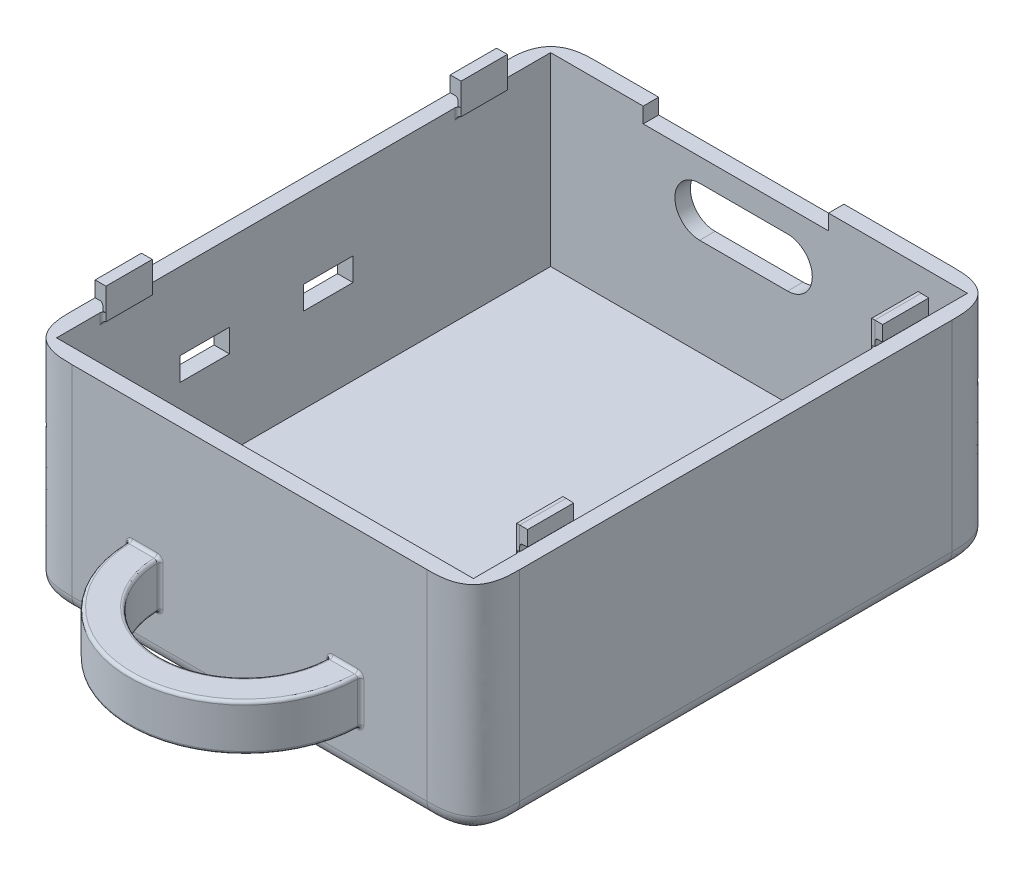
from build123d import *

# Parameters (mm, degrees)
SKETCH1_W              = 29
SKETCH1_H              = 34
BOTTOM_EXTRUDE_DEPTH   = 14
SID_CORNER_FILLET_SIZE = 3
BOTTOM_FILLET_R        = 1
SKETCH2_W              = 27
SKETCH2_H              = 32
CUT_EXTRUDE1_DEPTH     = 12
BOSS_EXTRUDE1_DEPTH    = 3
FILLET1_R              = 0.2
CUT_USB_REACH          = 156.905
SKETCH22_W             = 12
SKETCH22_H             = 1
SKETCH23_W             = 3.2
SKETCH23_H             = 1.5
CUT_BT_DEPTH           = 1
LPATTERN1_COUNT        = 2
LPATTERN1_PITCH        = 8
SKETCH24_W             = 3
SKETCH24_H             = 2
BOSS_CLIP_DEPTH        = 0.2
SKETCH26_W             = 3
SKETCH26_H             = 1
BOSS_CLIPEXT_DEPTH     = 0.5
BOSS_CLIPEXT_TAPER     = 1
FILLET2_R              = 0.2
LPATTERN2_COUNT        = 2
LPATTERN2_PITCH        = 23
FILLET2_OF_LPATTERN2_R = 0.2
SKETCH27_W             = 3
SKETCH27_H             = 2
BOSS_CLIP1_DEPTH       = 0.2
SKETCH28_W             = 3
SKETCH28_H             = 1
BOSS_CLIPEXT1_DEPTH    = 0.5
FILLET4_R              = 0.2
LPATTERN4_COUNT        = 2
LPATTERN4_PITCH        = 23
FILLET4_OF_LPATTERN4_R = 0.2


# Some blends are built 0.0001 mm under size
with BuildPart() as part:
    # Sketch1 → Bottom-Extrude (new body)
    with BuildSketch(Plane(origin=(0, 0, 0), x_dir=(1, 0, 0), z_dir=(0, 1, 0))):
        with Locations((-134.084269663, 79.775280899)):
            Rectangle(SKETCH1_W, SKETCH1_H)
    extrude(amount=BOTTOM_EXTRUDE_DEPTH)

    # Sid_Corner-Fillet
    # a fillet whose section is not a circle: 3 mm, written as the material it takes off along each edge
    with BuildSketch(Plane(origin=(-119.584269663, -7.5, -62.775280899), x_dir=(0, 0, -1), z_dir=(0, 1, 0)), Plane(origin=(-148.584269663, -7.5, -62.775280899), x_dir=(1, 0, 0), z_dir=(0, 1, 0)), Plane(origin=(-119.584269663, -7.5, -96.775280899), x_dir=(-1, 0, 0), z_dir=(0, 1, 0))) as sid_corner_fillet_piece_1:
        with BuildLine():
            add(Edge.make_bspline([(SID_CORNER_FILLET_SIZE, 0), (SID_CORNER_FILLET_SIZE * 0.831801948466, 0), (SID_CORNER_FILLET_SIZE * 0.663603896932, 0), (SID_CORNER_FILLET_SIZE * 0.292893218813, SID_CORNER_FILLET_SIZE * 0.0716919198361), (SID_CORNER_FILLET_SIZE * 0.0716919198361, SID_CORNER_FILLET_SIZE * 0.292893218813), (0, SID_CORNER_FILLET_SIZE * 0.663603896932), (0, SID_CORNER_FILLET_SIZE * 0.831801948466), (0, SID_CORNER_FILLET_SIZE)], knots=[0, 0, 0, 0, 0, 0, 0.5, 0.5, 1, 1, 1, 1, 1, 1], degree=5))
            Line((0, SID_CORNER_FILLET_SIZE), (0, 0))
            Line((0, 0), (SID_CORNER_FILLET_SIZE, 0))
        make_face()
    extrude(amount=29, mode=Mode.SUBTRACT)
    with BuildSketch(Plane(origin=(-148.584269663, -7.5, -96.775280899), x_dir=(1, 0, 0), z_dir=(0, 1, 0))) as sid_corner_fillet_piece_2:
        with BuildLine():
            add(Edge.make_bspline([(SID_CORNER_FILLET_SIZE, 0), (SID_CORNER_FILLET_SIZE * 0.831801948466, 0), (SID_CORNER_FILLET_SIZE * 0.663603896932, 0), (SID_CORNER_FILLET_SIZE * 0.292893218813, -SID_CORNER_FILLET_SIZE * 0.0716919198361), (SID_CORNER_FILLET_SIZE * 0.0716919198361, -SID_CORNER_FILLET_SIZE * 0.292893218813), (0, -SID_CORNER_FILLET_SIZE * 0.663603896932), (0, -SID_CORNER_FILLET_SIZE * 0.831801948466), (0, -SID_CORNER_FILLET_SIZE)], knots=[0, 0, 0, 0, 0, 0, 0.5, 0.5, 1, 1, 1, 1, 1, 1], degree=5))
            Line((0, -SID_CORNER_FILLET_SIZE), (0, 0))
            Line((0, 0), (SID_CORNER_FILLET_SIZE, 0))
        make_face()
    extrude(amount=29, mode=Mode.SUBTRACT)

    # Bottom-Fillet
    bottom_fillet_edges = [part.edges().sort_by_distance(p)[0] for p in [
        (-134.084269663, 0, -96.775280899),
        (-148.584269663, 0, -79.775280899),
        (-134.084269663, 0, -62.775280899),
        (-119.584269663, 0, -79.775280899),
        (-120.243279405, 0, -96.116271157),
        (-147.925259921, 0, -96.116271157),
        (-147.925259921, 0, -63.434290641),
        (-120.243279405, 0, -63.434290641),
    ]]
    fillet(bottom_fillet_edges, radius=BOTTOM_FILLET_R)

    # Sketch2 → Cut-Extrude1 (cut)
    with BuildSketch(Plane(origin=(0, 14, 0), x_dir=(1, 0, 0), z_dir=(0, 1, 0))):
        with Locations((-134.084269663, 79.775280899)):
            Rectangle(SKETCH2_W, SKETCH2_H)
    extrude(amount=-CUT_EXTRUDE1_DEPTH, mode=Mode.SUBTRACT)

    # Sketch21 → Boss-Extrude1 (add)
    with BuildSketch(Plane(origin=(0, 3, 0), x_dir=(-1, 0, 0), z_dir=(0, -1, 0))):
        with BuildLine():
            ThreePointArc((126.880155272, 62.775280899), (134.380155272, 55.275280899), (141.880155272, 62.775280899))
            Line((141.880155272, 62.775280899), (139.880155272, 62.775280899))
            ThreePointArc((139.880155272, 62.775280899), (134.380155272, 57.275280899), (128.880155272, 62.775280899))
            Line((128.880155272, 62.775280899), (126.880155272, 62.775280899))
        make_face()
    extrude(amount=-BOSS_EXTRUDE1_DEPTH)

    # Fillet1
    fillet1_edges = [part.edges().sort_by_distance(p)[0] for p in [
        (-134.380155272, 3, -57.275280899),
        (-128.880155272, 4.5, -62.775280899),
        (-140.880155272, 6, -62.775280899),
        (-139.880155272, 4.5, -62.775280899),
        (-134.380155272, 6, -55.275280899),
        (-141.880155272, 4.5, -62.775280899),
        (-127.880155272, 6, -62.775280899),
        (-126.880155272, 4.5, -62.775280899),
        (-134.380155272, 6, -57.275280899),
        (-127.880155272, 3, -62.775280899),
        (-134.380155272, 3, -55.275280899),
        (-140.880155272, 3, -62.775280899),
    ]]
    fillet(fillet1_edges, radius=FILLET1_R)

    # Sketch22 → Cut-USB (cut, up to next)
    with BuildSketch(Plane(origin=(0, 0, -96.775280899), x_dir=(-1, 0, 0), z_dir=(0, 0, -1)), mode=Mode.PRIVATE) as cut_usb_sk1:
        with BuildLine():
            Line((132.234269663, 11.5), (137.934269663, 11.5))
            ThreePointArc((137.934269663, 11.5), (139.534269663, 9.9), (137.934269663, 8.3))
            Line((137.934269663, 8.3), (132.234269663, 8.3))
            ThreePointArc((132.234269663, 8.3), (130.634269663, 9.9), (132.234269663, 11.5))
        make_face()
    cut_usb_tool1 = extrude(cut_usb_sk1.sketch, amount=-CUT_USB_REACH, mode=Mode.PRIVATE) & part.part
    # Sketch22 → Cut-USB (cut, up to next)
    with BuildSketch(Plane(origin=(0, 0, -96.775280899), x_dir=(-1, 0, 0), z_dir=(0, 0, -1)), mode=Mode.PRIVATE) as cut_usb_sk2:
        with Locations((135.584269663, 13.5)):
            Rectangle(SKETCH22_W, SKETCH22_H)
    cut_usb_tool2 = extrude(cut_usb_sk2.sketch, amount=-CUT_USB_REACH, mode=Mode.PRIVATE) & part.part
    add(cut_usb_tool1.solids().sort_by_distance((-135.08427, 9.9, -96.775281))[0], mode=Mode.SUBTRACT)
    add(cut_usb_tool2.solids().sort_by_distance((-135.58427, 13.5, -96.775281))[0], mode=Mode.SUBTRACT)

    # Sketch23 → Cut-BT (cut)
    with BuildSketch(Plane.ZY.offset(148.584269663)):
        with Locations((-73.375280899, 8.25)):
            Rectangle(SKETCH23_W, SKETCH23_H)
    cut_bt = extrude(amount=-CUT_BT_DEPTH, mode=Mode.SUBTRACT)

    # LPattern1: Cut-BT ×2
    with Locations(*[(0, 0, -i * LPATTERN1_PITCH) for i in range(1, LPATTERN1_COUNT)]):
        add(cut_bt, mode=Mode.SUBTRACT)

    # Sketch24 → Boss-Clip (add)
    with BuildSketch(Plane.ZY.offset(120.584269663)):
        with Locations((-68.275280899, 14.5)):
            Rectangle(SKETCH24_W, SKETCH24_H)
    boss_clip = extrude(amount=BOSS_CLIP_DEPTH)

    # Sketch26 → Boss-ClipExt (add)
    with BuildSketch(Plane(origin=(-120.584269663, 0, 0), x_dir=(0, 0, -1), z_dir=(1, 0, 0))):
        with Locations((68.275280899, 15)):
            Rectangle(SKETCH26_W, SKETCH26_H)
    boss_clipext = extrude(amount=BOSS_CLIPEXT_DEPTH, taper=BOSS_CLIPEXT_TAPER)

    # Fillet2
    fillet2_edges = [part.edges().sort_by_distance(p)[0] for p in [
        (-120.584269663, 13.75, -69.775280899),
        (-120.584269663, 13.75, -66.775280899),
        (-120.584269663, 13.5, -68.275280899),
        (-120.584269663, 14.5, -68.275280899),
    ]]
    fillet(fillet2_edges, radius=FILLET2_R - 0.0001)  # a hair under: the kernel refuses the full size

    # LPattern2: Boss-Clip, Boss-ClipExt ×2
    with Locations(*[(0, 0, -i * LPATTERN2_PITCH) for i in range(1, LPATTERN2_COUNT)]):
        add(boss_clip)
        add(boss_clipext)

    # Fillet2 of LPattern2
    fillet2_of_lpattern2_edges = [part.edges().sort_by_distance(p)[0] for p in [
        (-120.584269663, 13.75, -92.775280899),
        (-120.584269663, 13.75, -89.775280899),
        (-120.584269663, 13.5, -91.275280899),
        (-120.584269663, 14.5, -91.275280899),
    ]]
    fillet(fillet2_of_lpattern2_edges, radius=FILLET2_OF_LPATTERN2_R - 0.0001)  # a hair under: the kernel refuses the full size

    # Sketch27 → Boss-Clip1 (add)
    with BuildSketch(Plane(origin=(-147.584269663, 0, 0), x_dir=(0, 0, -1), z_dir=(1, 0, 0))):
        with Locations((68.275280899, 14.5)):
            Rectangle(SKETCH27_W, SKETCH27_H)
    boss_clip1 = extrude(amount=BOSS_CLIP1_DEPTH)

    # Sketch28 → Boss-ClipExt1 (add)
    with BuildSketch(Plane.ZY.offset(147.584269663)):
        with Locations((-68.275280899, 15)):
            Rectangle(SKETCH28_W, SKETCH28_H)
    boss_clipext1 = extrude(amount=BOSS_CLIPEXT1_DEPTH)

    # Fillet4
    fillet4_edges = [part.edges().sort_by_distance(p)[0] for p in [
        (-147.584269663, 14.5, -68.275280899),
        (-147.584269663, 13.75, -69.775280899),
        (-147.584269663, 13.5, -68.275280899),
        (-147.584269663, 13.75, -66.775280899),
    ]]
    fillet(fillet4_edges, radius=FILLET4_R - 0.0001)  # a hair under: the kernel refuses the full size

    # LPattern4: Boss-Clip1, Boss-ClipExt1 ×2
    with Locations(*[(0, 0, -i * LPATTERN4_PITCH) for i in range(1, LPATTERN4_COUNT)]):
        add(boss_clip1)
        add(boss_clipext1)

    # Fillet4 of LPattern4
    fillet4_of_lpattern4_edges = [part.edges().sort_by_distance(p)[0] for p in [
        (-147.584269663, 14.5, -91.275280899),
        (-147.584269663, 13.75, -92.775280899),
        (-147.584269663, 13.5, -91.275280899),
        (-147.584269663, 13.75, -89.775280899),
    ]]
    fillet(fillet4_of_lpattern4_edges, radius=FILLET4_OF_LPATTERN4_R - 0.0001)  # a hair under: the kernel refuses the full size


solid = part.part
